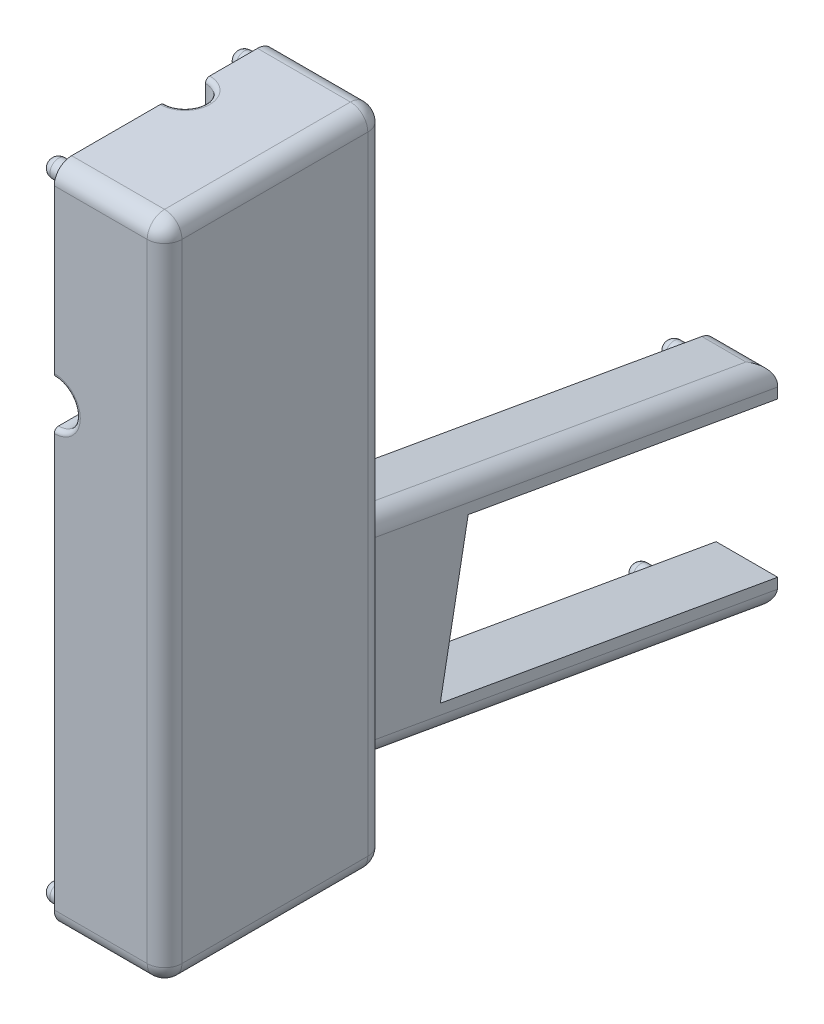
from build123d import *

# Parameters (mm, degrees)
SKETCH1_W                = 25.4
SKETCH1_H                = 50.8
BOSS_EXTRUDE1_DEPTH      = 152.4
SKETCH2_W                = 38.1
SKETCH2_H                = 139.7
CUT_EXTRUDE1_DEPTH       = 19.05
HITLED_REACH             = 164.639
IRLED_REACH              = 158.705
SKETCH6_W                = 6.35
SKETCH6_H                = 101.6
PCB_DEPTH                = 6.35
BUTT_DEPTH               = 14.175
BATTERYPACK_REACH        = 219.018
FILLET_BODY_R            = 4
FILLET_LEDS_R            = 1
SKETCH16_R               = 2
PRESSFIT_DEPTH           = 5
FILLET_PRESSFIT_R        = 2
SKETCH17_R               = 2
PRESSFIT_BOTTOM_DEPTH    = 5
FILLET_PRESSFIT_BOTTOM_R = 2


with BuildPart() as part:
    # Sketch1 → Boss-Extrude1 (new body)
    with BuildSketch(Plane(origin=(0, 0, 0), x_dir=(1, 0, 0), z_dir=(0, 1, 0))):
        with Locations((12.7, 25.4)):
            Rectangle(SKETCH1_W, SKETCH1_H)
    extrude(amount=BOSS_EXTRUDE1_DEPTH)

    # Sketch2 → Cut-Extrude1 (cut)
    with BuildSketch(Plane.ZY):
        with Locations((-25.4, 76.2)):
            Rectangle(SKETCH2_W, SKETCH2_H)
    extrude(amount=-CUT_EXTRUDE1_DEPTH, mode=Mode.SUBTRACT)

    # Sketch3 → HitLED (cut, up to next)
    with BuildSketch(Plane.XY, mode=Mode.PRIVATE) as hitled_sk1:
        with BuildLine():
            Line((0, 110), (0, 100))
            ThreePointArc((0, 100), (5, 105), (0, 110))
        make_face()
    hitled_tool1 = extrude(hitled_sk1.sketch, amount=-HITLED_REACH, mode=Mode.PRIVATE) & part.part
    add(hitled_tool1.solids().sort_by_distance((2.122066, 105, 0))[0], mode=Mode.SUBTRACT)

    # Sketch5 → IRLED (cut, up to next)
    with BuildSketch(Plane.XZ.offset(-146.05), mode=Mode.PRIVATE) as irled_sk1:
        with BuildLine():
            Line((0, -25.4), (0, -34.8))
            ThreePointArc((0, -34.8), (4.7, -30.1), (0, -25.4))
        make_face()
    irled_tool1 = extrude(irled_sk1.sketch, amount=-IRLED_REACH, mode=Mode.PRIVATE) & part.part
    add(irled_tool1.solids().sort_by_distance((1.994742, 146.05, -30.1))[0], mode=Mode.SUBTRACT)

    # Sketch6 → PCB (add)
    with BuildSketch(Plane.ZY.offset(-19.05)):
        with Locations((-30.355, 95.25)):
            Rectangle(SKETCH6_W, SKETCH6_H)
        with Locations((-38.275, 95.25)):
            Rectangle(SKETCH6_W, SKETCH6_H)
    extrude(amount=PCB_DEPTH)

    # Sketch13 → Butt (add)
    with BuildSketch(Plane(origin=(0, 0, -25.4), x_dir=(0, 0, 1), z_dir=(-1, 0, 0))):
        Polygon((-25.4, 61.135849387), (-25.4, 12.7), (-127, -5.21482124), (-127, 43.221028147), align=None)
    extrude(amount=-BUTT_DEPTH)

    # Sketch15 → BatteryPack (cut, up to next)
    with BuildSketch(Plane.ZY, mode=Mode.PRIVATE) as batterypack_sk1:
        Polygon((-81.135596448, 49.338906272), (-74.703300004, 14.933162267), (-141.673771116, 3.124461299), (-152.4, 1.233137745), (-152.4, 36.773069161), (-148.10606756, 37.530205304), align=None)
    batterypack_tool1 = extrude(batterypack_sk1.sketch, amount=-BATTERYPACK_REACH, mode=Mode.PRIVATE) & part.part
    add(batterypack_tool1.solids().sort_by_distance((0, 25.317875, -115.136578))[0], mode=Mode.SUBTRACT)

    # Fillet-Body
    fillet_body_edges = [part.edges().sort_by_distance(p)[0] for p in [
        (14.175, 3.74258938, -101.6),
        (7.0875, -5.21482124, -152.4),
        (7.0875, 12.7, -50.8),
        (14.175, 36.917924693, -50.8),
        (7.0875, 43.221028147, -152.4),
        (14.175, 52.178438767, -101.6),
        (7.0875, 61.135849387, -50.8),
        (12.7, 152.4, -50.8),
        (12.7, 152.4, 0),
        (25.4, 152.4, -25.4),
        (25.4, 76.2, -50.8),
        (25.4, 76.2, 0),
        (25.4, 0, -25.4),
        (12.7, 0, -50.8),
        (12.7, 0, 0),
    ]]
    fillet(fillet_body_edges, radius=FILLET_BODY_R)

    # Fillet-LEDs
    fillet_leds_edges = [part.edges().sort_by_distance(p)[0] for p in [
        (4.7, 152.4, -30.1),
        (5, 105, 0),
    ]]
    fillet(fillet_leds_edges, radius=FILLET_LEDS_R)

    # Sketch16 → PressFit (add)
    with BuildSketch(Plane.ZY):
        with Locations((-4, 148.4)):
            Circle(SKETCH16_R)
        with Locations((-4, 4)):
            Circle(SKETCH16_R)
        with Locations((-46.8, 148.4)):
            Circle(SKETCH16_R)
        with Locations((-46.8, 4)):
            Circle(SKETCH16_R)
    extrude(amount=PRESSFIT_DEPTH)

    # Fillet-PressFit
    fillet_pressfit_edges = [part.edges().sort_by_distance(p)[0] for p in [
        (-5, 4, -48.8),
        (-5, 4, -6),
        (-5, 148.4, -48.8),
        (-5, 148.4, -6),
    ]]
    fillet(fillet_pressfit_edges, radius=FILLET_PRESSFIT_R)

    # Sketch17 → PressFit-Bottom (add)
    with BuildSketch(Plane.ZY):
        with Locations((-145.73498913, 41.172269897)):
            Circle(SKETCH17_R)
        with Locations((-138.135690331, 0.524340909)):
            Circle(SKETCH17_R)
    extrude(amount=PRESSFIT_BOTTOM_DEPTH)

    # Fillet-PressFit-Bottom
    fillet_pressfit_bottom_edges = [part.edges().sort_by_distance(p)[0] for p in [
        (-5, 0.524340909, -140.135690331),
        (-5, 41.172269897, -147.73498913),
    ]]
    fillet(fillet_pressfit_bottom_edges, radius=FILLET_PRESSFIT_BOTTOM_R)


solid = part.part
